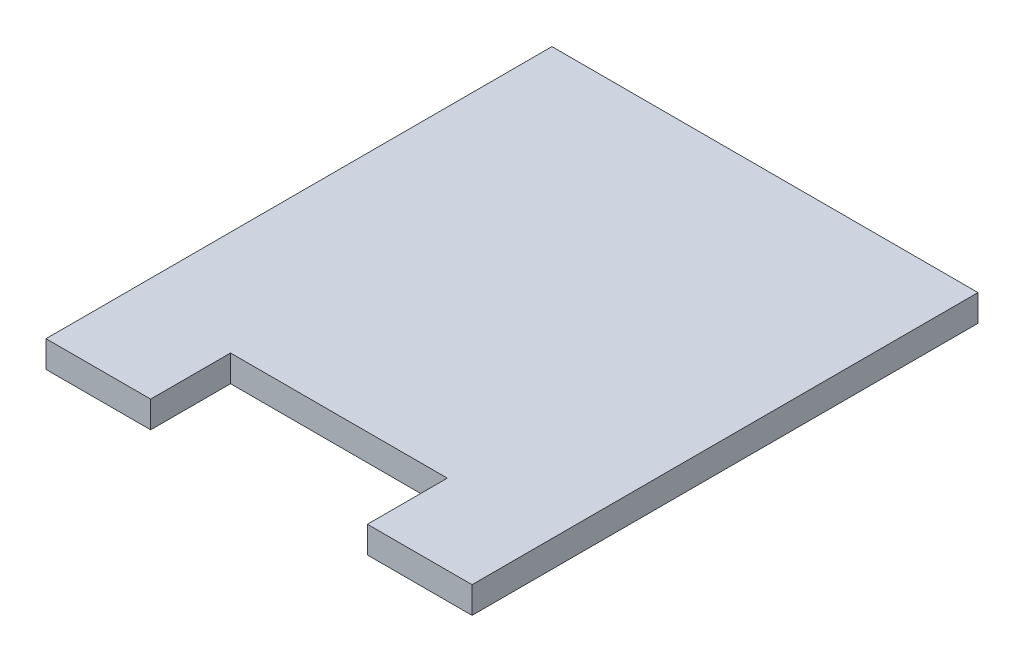
from build123d import *

# Parameters (mm, degrees)
BOSS_EXTRUDE1_DEPTH = 3.175


with BuildPart() as part:
    # Sketch1 → Boss-Extrude1 (new body)
    with BuildSketch(Plane(origin=(0, 0, 0), x_dir=(1, 0, 0), z_dir=(0, 1, 0))):
        Polygon((0, 0), (50.8, 0), (50.8, -60.325), (38.32225, -60.325), (38.32225, -50.8), (12.47775, -50.8), (12.47775, -60.325), (0, -60.325), align=None)
    extrude(amount=BOSS_EXTRUDE1_DEPTH)


solid = part.part
